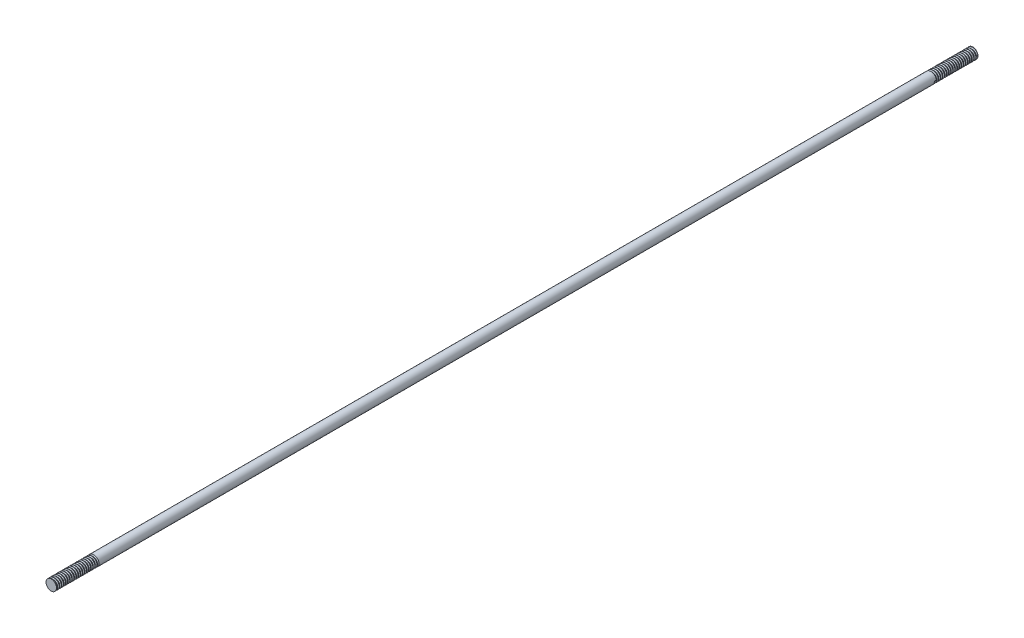
from build123d import *
from build123d.topology import SkipClean

# Parameters (mm, degrees)
SKETCH1_R           = 3.175
BOSS_EXTRUDE1_DEPTH = 558.8
THREAD2_PITCH       = 1.27
THREAD3_PITCH       = 1.27


with BuildPart() as part:
    # Sketch1 → Boss-Extrude1 (new body)
    with BuildSketch(Plane.XY):
        Circle(SKETCH1_R)
    extrude(amount=BOSS_EXTRUDE1_DEPTH)

    # Thread2: the profile of Thread Profile1 profile screwed along a right-hand helix of 20 turns, 8 arcs to a turn; built about Z, then put on its axis
    with SkipClean():  # the faces are left unmerged after this step: merging them gives an invalid solid
        thread2_z = Axis((0, 0, 0), (0, 0, 1))
        thread2_corners = [(3.1753, -1e-09, -0.000173205), (3.1753, -1e-09, 1.111423202), (2.487592339, -1e-09, 0.714374998), (2.487592339, -1e-09, 0.396874998)]
        with BuildLine(mode=Mode.PRIVATE) as thread2_profile:
            Line(thread2_corners[0], thread2_corners[1])
            Line(thread2_corners[1], thread2_corners[2])
            Line(thread2_corners[2], thread2_corners[3])
            Line(thread2_corners[3], thread2_corners[0])
        thread2_cap = Face(thread2_profile.wire())
        thread2_turn_angles = [0, 22.5, 45, 67.5, 90, 112.5, 135, 157.5, 180, 202.5, 225, 247.5, 270, 292.5, 315, 337.5, 360]
        thread2_turn_weights = [1, 0.9238795325112867, 1, 0.9238795325112867, 1, 0.9238795325112867, 1, 0.9238795325112867, 1, 0.9238795325112867, 1, 0.9238795325112867, 1, 0.9238795325112867, 1, 0.9238795325112867, 1]
        thread2_turn_rails = [Edge.make_bspline([Vector(p[0], p[1], 0).rotate(thread2_z, thread2_turn_angles[k]) / thread2_turn_weights[k] + Vector(0, 0, p[2] + THREAD2_PITCH * thread2_turn_angles[k] / 360) for k in range(17)], [0, 0, 0, 1, 1, 2, 2, 3, 3, 4, 4, 5, 5, 6, 6, 7, 7, 8, 8, 8], 2, thread2_turn_weights) for p in thread2_corners]
        thread2_turn_sides = [Face.make_surface_from_curves(thread2_turn_rails[p[0]], thread2_turn_rails[p[1]]) for p in [(0, 1), (1, 2), (2, 3), (3, 0)]]
        thread2 = Plane(origin=(0, 0, 0), x_dir=(0.999390827, 0.034899497, 0), z_dir=(0, 0, 1)) * Solid(Shell([*[p.moved(Location((0, 0, THREAD2_PITCH * i))) for i in range(20) for p in thread2_turn_sides], thread2_cap, thread2_cap.rotate(thread2_z, 7200).moved(Location((0, 0, THREAD2_PITCH * 7200 / 360)))]))
        add(thread2, mode=Mode.SUBTRACT)

    # Thread3: the profile of Thread Profile2 profile screwed along a right-hand helix of 20 turns, 8 arcs to a turn; built about Z, then put on its axis
    with SkipClean():  # the faces are left unmerged after this step: merging them gives an invalid solid
        thread3_z = Axis((0, 0, 0), (0, 0, 1))
        thread3_corners = [(3.1753, -1e-09, -0.000173205), (3.1753, -1e-09, 1.111423202), (2.487592339, -1e-09, 0.714374998), (2.487592339, -1e-09, 0.396874998)]
        with BuildLine(mode=Mode.PRIVATE) as thread3_profile:
            Line(thread3_corners[0], thread3_corners[1])
            Line(thread3_corners[1], thread3_corners[2])
            Line(thread3_corners[2], thread3_corners[3])
            Line(thread3_corners[3], thread3_corners[0])
        thread3_cap = Face(thread3_profile.wire())
        thread3_turn_angles = [0, 22.5, 45, 67.5, 90, 112.5, 135, 157.5, 180, 202.5, 225, 247.5, 270, 292.5, 315, 337.5, 360]
        thread3_turn_weights = [1, 0.9238795325112867, 1, 0.9238795325112867, 1, 0.9238795325112867, 1, 0.9238795325112867, 1, 0.9238795325112867, 1, 0.9238795325112867, 1, 0.9238795325112867, 1, 0.9238795325112867, 1]
        thread3_turn_rails = [Edge.make_bspline([Vector(p[0], p[1], 0).rotate(thread3_z, thread3_turn_angles[k]) / thread3_turn_weights[k] + Vector(0, 0, p[2] + THREAD3_PITCH * thread3_turn_angles[k] / 360) for k in range(17)], [0, 0, 0, 1, 1, 2, 2, 3, 3, 4, 4, 5, 5, 6, 6, 7, 7, 8, 8, 8], 2, thread3_turn_weights) for p in thread3_corners]
        thread3_turn_sides = [Face.make_surface_from_curves(thread3_turn_rails[p[0]], thread3_turn_rails[p[1]]) for p in [(0, 1), (1, 2), (2, 3), (3, 0)]]
        thread3 = Plane(origin=(0, 0, 558.8), x_dir=(-0.999390827, 0.034899497, 0), z_dir=(0, 0, -1)) * Solid(Shell([*[p.moved(Location((0, 0, THREAD3_PITCH * i))) for i in range(20) for p in thread3_turn_sides], thread3_cap, thread3_cap.rotate(thread3_z, 7200).moved(Location((0, 0, THREAD3_PITCH * 7200 / 360)))]))
        add(thread3, mode=Mode.SUBTRACT)


solid = part.part
